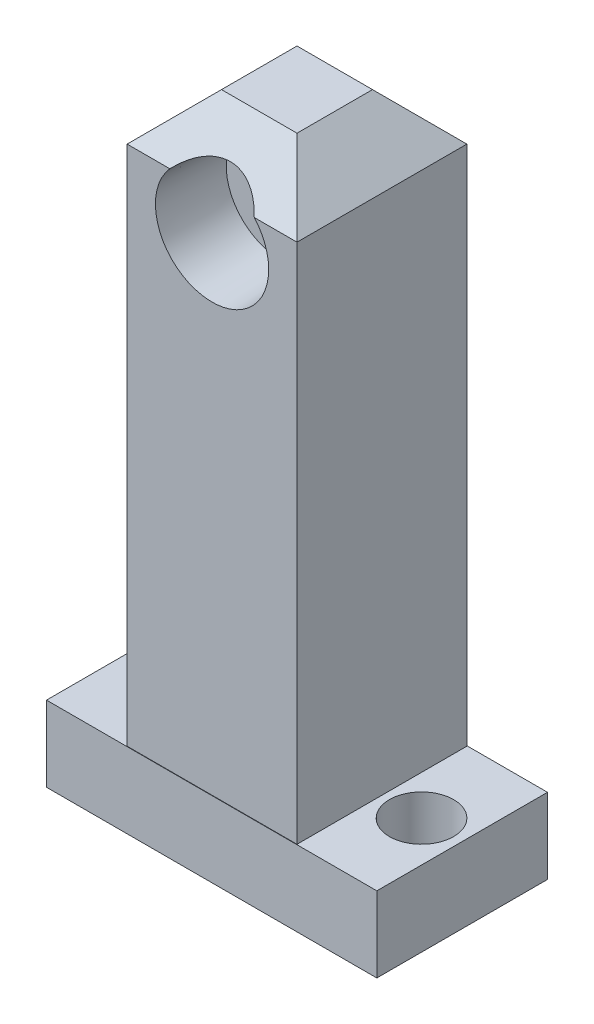
from build123d import *

# Parameters (mm, degrees)
SKETCH4_W           = 18
SKETCH4_H           = 18
BOSS_EXTRUDE2_DEPTH = 9
SKETCH5_R           = 3.15
CUT_EXTRUDE1_DEPTH  = 18
SKETCH6_R           = 6
CUT_EXTRUDE2_DEPTH  = 7.25
CUT_EXTRUDE2_DRAFT  = -2
SKETCH8_R           = 6
CUT_EXTRUDE3_DEPTH  = 7.25
CUT_EXTRUDE3_DRAFT  = -2
CHAMFER1_SIZE       = 5
SKETCH13_W          = 18
SKETCH13_H          = 18
BOSS_EXTRUDE4_DEPTH = 50.25
SKETCH14_W          = 35
SKETCH14_H          = 18.08381725
BOSS_EXTRUDE5_DEPTH = 8
SKETCH15_R          = 3.4
CUT_EXTRUDE4_DEPTH  = 8
SKETCH16_R          = 3.4
CUT_EXTRUDE5_DEPTH  = 8


with BuildPart() as part:
    # Sketch4 → Boss-Extrude2 (new, symmetric)
    with BuildSketch(Plane(origin=(0, 0, 0), x_dir=(1, 0, 0), z_dir=(0, 1, 0))):
        Rectangle(SKETCH4_W, SKETCH4_H)
    extrude(amount=BOSS_EXTRUDE2_DEPTH, both=True)

    # Sketch5 → Cut-Extrude1 (cut)
    with BuildSketch(Plane.XY.offset(9)):
        Circle(SKETCH5_R)
    extrude(amount=-CUT_EXTRUDE1_DEPTH, mode=Mode.SUBTRACT)


with BuildPart() as cut_extrude2_tool:
    # Sketch6 → Cut-Extrude2 (with draft: the straight prism first)
    with BuildSketch(Plane.XY.offset(9)):
        Circle(SKETCH6_R)
    extrude(amount=-CUT_EXTRUDE2_DEPTH)
    # Cut-Extrude2: the draft: its side faces are tilted about the plane it starts from
    cut_extrude2_sides = [cut_extrude2_tool.faces().sort_by_distance(p)[0] for p in [
        (-6, 0, 5.375),
    ]]
    draft(cut_extrude2_sides, Plane.XY.offset(9), CUT_EXTRUDE2_DRAFT)


with BuildPart() as part_1:
    add(part.part)

    # Cut-Extrude2: cut by cut_extrude2_tool
    add(cut_extrude2_tool.part, mode=Mode.SUBTRACT)


with BuildPart() as cut_extrude3_tool:
    # Sketch8 → Cut-Extrude3 (with draft: the straight prism first)
    with BuildSketch(Plane(origin=(0, 0, -9), x_dir=(-1, 0, 0), z_dir=(0, 0, -1))):
        Circle(SKETCH8_R)
    extrude(amount=-CUT_EXTRUDE3_DEPTH)
    # Cut-Extrude3: the draft: its side faces are tilted about the plane it starts from
    cut_extrude3_sides = [cut_extrude3_tool.faces().sort_by_distance(p)[0] for p in [
        (6, 0, -5.375),
    ]]
    draft(cut_extrude3_sides, Plane(origin=(0, 0, -9), x_dir=(-1, 0, 0), z_dir=(0, 0, -1)), CUT_EXTRUDE3_DRAFT)


with BuildPart() as part_2:
    add(part_1.part)

    # Cut-Extrude3: cut by cut_extrude3_tool
    add(cut_extrude3_tool.part, mode=Mode.SUBTRACT)

    # Chamfer1
    # the kernel refuses this chamfer: 5 mm, written as the material it takes off along each edge
    with BuildSketch(Plane(origin=(-9, 9, 21.85841494), x_dir=(-0.027495876610586317, -0.9996219169112968, 0), z_dir=(0, 0, -1)), Plane(origin=(-21.85841494, 9, -9), x_dir=(0, -0.9996219169112968, -0.027495876610586317), z_dir=(1, 0, 0))) as chamfer1_piece_1:
        Polygon((CHAMFER1_SIZE * 0.999621916911, -CHAMFER1_SIZE * 0.0274958766106), (-CHAMFER1_SIZE * 0.0274958766106, -CHAMFER1_SIZE * 0.999621916911), (0, 0), align=None)
    extrude(amount=43.71682988, mode=Mode.SUBTRACT)
    with BuildSketch(Plane(origin=(21.85841494, 9, 9), x_dir=(0, 0.027495876610586317, -0.9996219169112968), z_dir=(-1, 0, 0)), Plane(origin=(9, 9, -21.85841494), x_dir=(-0.9996219169112968, 0.027495876610586317, 0), z_dir=(0, 0, 1))) as chamfer1_piece_2:
        Polygon((CHAMFER1_SIZE * 0.999621916911, CHAMFER1_SIZE * 0.0274958766106), (-CHAMFER1_SIZE * 0.0274958766106, CHAMFER1_SIZE * 0.999621916911), (0, 0), align=None)
    extrude(amount=43.71682988, mode=Mode.SUBTRACT)

    # Sketch13 → Boss-Extrude4 (add)
    with BuildSketch(Plane.XZ.offset(9)):
        Rectangle(SKETCH13_W, SKETCH13_H)
    extrude(amount=BOSS_EXTRUDE4_DEPTH)

    # Sketch14 → Boss-Extrude5 (add)
    with BuildSketch(Plane(origin=(0, -59.25, 0), x_dir=(-1, 0, 0), z_dir=(0, -1, 0))):
        Rectangle(SKETCH14_W, SKETCH14_H)
    extrude(amount=-BOSS_EXTRUDE5_DEPTH)

    # Sketch15 → Cut-Extrude4 (cut)
    with BuildSketch(Plane(origin=(0, -51.25, 0), x_dir=(1, 0, 0), z_dir=(0, 1, 0))):
        with Locations(Location((-13.069976583, 0, 0), (0, 0, 270))):
            Circle(SKETCH15_R)
    extrude(amount=-CUT_EXTRUDE4_DEPTH, mode=Mode.SUBTRACT)

    # Sketch16 → Cut-Extrude5 (cut)
    with BuildSketch(Plane(origin=(0, -51.25, 0), x_dir=(1, 0, 0), z_dir=(0, 1, 0))):
        with Locations(Location((13.194452551, 0, 0), (0, 0, 270))):
            Circle(SKETCH16_R)
    extrude(amount=-CUT_EXTRUDE5_DEPTH, mode=Mode.SUBTRACT)


solid = part_2.part
